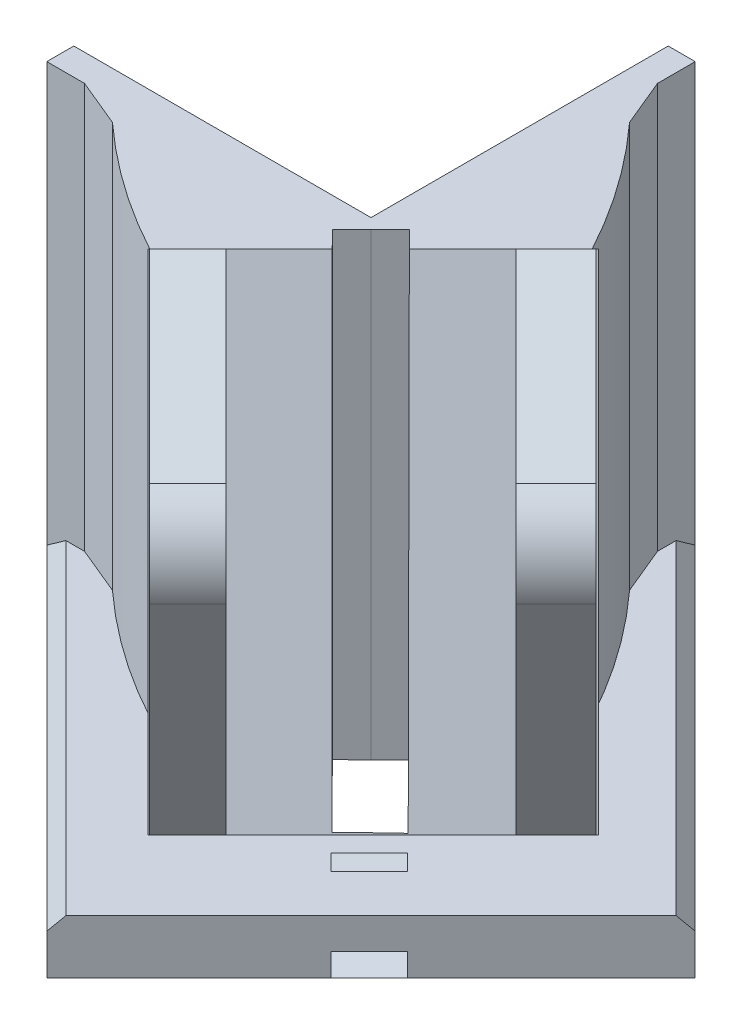
from build123d import *

# Parameters (mm, degrees)
EXTRUDE_1_DEPTH          = 150
EXTRUDE_2_DEPTH          = 150
CUT_EXTRUDE_3_DEPTH      = 161
CHAMFER_4_SIZE           = 10
CHAMFER_5_SIZE           = 10
EXTRUDE_7_DEPTH          = 20
CHAMFER_6_SIZE           = 5
CHAMFER_7_SIZE           = 5
EXTRUDE_8_DEPTH          = 58
EXTRUDE_8_DEPTH_BACK     = 60
EXTRUDE_9_DEPTH          = 20
EXTRUDE_17_DEPTH         = 20
EXTRUDE_17_DEPTH_BACK    = 1
CUT_EXTRUDE_6_DEPTH      = 276.322275262
CUT_EXTRUDE_6_DEPTH_BACK = 276.322275262
SKETCH_13_R              = 10
CUT_EXTRUDE_8_DEPTH      = 10
CUT_EXTRUDE_8_DEPTH_BACK = 10
CUT_EXTRUDE_9_DEPTH      = 31
CUT_EXTRUDE_9_DEPTH_BACK = 182


with BuildPart() as part:
    # 草图1 → 凸台-拉伸1 (new body)
    with BuildSketch(Plane(origin=(0, 0, 0), x_dir=(1, 0, 0), z_dir=(0, 1, 0))):
        Polygon((0, 0), (0, 110), (10, 110), (10, -10), (-110, -10), (-110, 0), align=None)
    extrude(amount=EXTRUDE_1_DEPTH)

    # 草图2 → 凸台-拉伸2 (add)
    with BuildSketch(Plane(origin=(0, 150, 0), x_dir=(1, 0, 0), z_dir=(0, 1, 0))):
        Polygon((10, 86.03773993), (10, -10), (58.018869965, 38.018869965), align=None)
        Polygon((-86.03773993, -10), (10, -10), (-38.018869965, -58.018869965), align=None)
    extrude(amount=-EXTRUDE_2_DEPTH)

    # 草图5 → 切除-拉伸3 (cut)
    with BuildSketch(Plane(origin=(0, 150, 0), x_dir=(1, 0, 0), z_dir=(0, 1, 0))):
        with BuildLine():
            Line((-86.03773993, -10), (-38.018869965, -58.018869965))
            Line((-38.018869965, -58.018869965), (-30.947802153, -50.947802153))
            ThreePointArc((-30.947802153, -50.947802153), (-59.992139056, -32.491105573), (-86.03773993, -10))
        make_face()
        with BuildLine():
            Line((10, 86.03773993), (58.018869965, 38.018869965))
            Line((58.018869965, 38.018869965), (50.947802153, 30.947802153))
            ThreePointArc((50.947802153, 30.947802153), (32.491105573, 59.992139056), (10, 86.03773993))
        make_face()
    extrude(amount=-CUT_EXTRUDE_3_DEPTH, mode=Mode.SUBTRACT)

    # 倒角4
    # the kernel refuses this chamfer: 10 mm, written as the material it adds along each edge
    with BuildSketch(Plane(origin=(-86.03773993, 150, 10), x_dir=(-1, 0, 0), z_dir=(0, -1, 0))) as chamfer_4_piece_1:
        with BuildLine():
            Line((CHAMFER_4_SIZE, 0), (-7.644165176, -7.308452513))
            ThreePointArc((-7.644165176, -7.308452513), (-3.915956427, -3.825991439), (0, 0))
            Line((0, 0), (CHAMFER_4_SIZE, 0))
        make_face()
    extrude(amount=150)

    # 倒角5
    # the kernel refuses this chamfer: 10 mm, written as the material it adds along each edge
    with BuildSketch(Plane(origin=(10, 150, -86.03773993), x_dir=(0.6910568330345163, 0, 0.7228004244024105), z_dir=(0, -1, 0))) as chamfer_5_piece_1:
        with BuildLine():
            Line((10.575761882, 0), (-CHAMFER_5_SIZE * 0.722800424402, -CHAMFER_5_SIZE * 0.691056833035))
            Line((-CHAMFER_5_SIZE * 0.722800424402, -CHAMFER_5_SIZE * 0.691056833035), (0, 0))
            ThreePointArc((0, 0), (5.474432495, -0.059279789), (10.575761882, 0))
        make_face()
    extrude(amount=150)

    # 草图8 → 凸台-拉伸7 (add)
    with BuildSketch(Plane(origin=(0, 0, 0), x_dir=(-1, 0, 0), z_dir=(0, -1, 0))):
        Polygon((110, 0), (0, 0), (0, 110), (-10, 110), (-133.743686708, -13.743686708), (-73.743686708, -73.743686708), (-13.743686708, -133.743686708), (110, -10), align=None)
    extrude(amount=EXTRUDE_7_DEPTH)

    # 倒角6
    chamfer_6_edges = [part.edges().sort_by_distance(p)[0] for p in [
        (-48.128156646, 0, 71.871843354),
    ]]
    chamfer(chamfer_6_edges, length=CHAMFER_6_SIZE)

    # 倒角7
    chamfer_7_edges = [part.edges().sort_by_distance(p)[0] for p in [
        (71.871843354, 0, -48.128156646),
    ]]
    chamfer(chamfer_7_edges, length=CHAMFER_7_SIZE)

    # 草图9 → 凸台-拉伸8 (add, two sides: drawn at the far end of the back side and taken through both)
    with BuildSketch(Plane(origin=(-0.289162235, 0, 0.289162235), x_dir=(0.7071067811865451, 0, 0.70710678118655), z_dir=(-0.70710678118655, 0, 0.7071067811865451)).offset(-EXTRUDE_8_DEPTH_BACK)):
        Polygon((14.142135624, 150), (67.756418231, 0), (14.142135624, 0), align=None)
    extrude(amount=EXTRUDE_8_DEPTH + EXTRUDE_8_DEPTH_BACK)

    # 草图10 → 凸台-拉伸9 (add)
    with BuildSketch(Plane(origin=(-40.947802153, 0, 40.947802153), x_dir=(0.7071067811865452, 0, 0.7071067811865498), z_dir=(-0.7071067811865498, 0, 0.7071067811865452))):
        with BuildLine():
            Line((14.142135624, 150), (87.333768107, 126.556202944))
            ThreePointArc((87.333768107, 126.556202944), (97.811967476, 112.737019173), (98.011481853, 95.395661207))
            Line((98.011481853, 95.395661207), (67.756418231, 0))
            Line((67.756418231, 0), (14.142135624, 150))
        make_face()
    extrude(amount=-EXTRUDE_9_DEPTH)

    # 草图12 → 凸台-拉伸17 (add, two sides: drawn at the far end of the back side and taken through both)
    with BuildSketch(Plane(origin=(40.947802153, 0, -40.947802153), x_dir=(0.7071067811865452, 0, 0.7071067811865498), z_dir=(-0.7071067811865498, 0, 0.7071067811865452)).offset(-EXTRUDE_17_DEPTH_BACK)):
        with BuildLine():
            Line((14.142135624, 150), (87.333768107, 126.556202944))
            ThreePointArc((87.333768107, 126.556202944), (97.811967476, 112.737019173), (98.011481853, 95.395661207))
            Line((98.011481853, 95.395661207), (67.756418231, 0))
            Line((67.756418231, 0), (14.142135624, 150))
        make_face()
    extrude(amount=EXTRUDE_17_DEPTH + EXTRUDE_17_DEPTH_BACK)

    # 草图13 → 切除-拉伸6 (cut, two sides: drawn at the far end of the back side and taken through both)
    with BuildSketch(Plane(origin=(-40.947802153, 0, 40.947802153), x_dir=(0.7071067811865452, 0, 0.7071067811865498), z_dir=(-0.7071067811865498, 0, 0.7071067811865452)).offset(-CUT_EXTRUDE_6_DEPTH_BACK)):
        with Locations((77.042401388, 104.51514855)):
            Circle(SKETCH_13_R)
    extrude(amount=CUT_EXTRUDE_6_DEPTH + CUT_EXTRUDE_6_DEPTH_BACK, mode=Mode.SUBTRACT)

    # 草图15 → 切除-拉伸8 (cut, two sides: drawn at the far end of the back side and taken through both)
    with BuildSketch(Plane(origin=(-0.289162235, 0, 0.289162235), x_dir=(0.7071067811865451, 0, 0.70710678118655), z_dir=(-0.70710678118655, 0, 0.7071067811865451)).offset(-CUT_EXTRUDE_8_DEPTH_BACK)):
        with BuildLine():
            Line((75.824326152, 0), (84.289321881, 0))
            ThreePointArc((84.289321881, 0), (93.528695136, -7.086316984), (104.289321881, -11.535004271))
            Line((104.289321881, -11.535004271), (104.289321881, -20))
            ThreePointArc((104.289321881, -20), (89.190074528, -11.233601025), (75.824326152, 0))
        make_face()
    extrude(amount=CUT_EXTRUDE_8_DEPTH + CUT_EXTRUDE_8_DEPTH_BACK, mode=Mode.SUBTRACT)

    # 草图18 → 切除-拉伸9 (cut, two sides: drawn at the far end of the back side and taken through both)
    with BuildSketch(Plane.XZ.offset(20).offset(-CUT_EXTRUDE_9_DEPTH_BACK)):
        Polygon((40.487345, 55.004008196), (-3.380540201, 10.938796408), (3.780279879, 3.810042897), (10.964971033, -3.294651596), (54.684805363, 40.917454531), (47.574262823, 47.948826004), align=None)
    extrude(amount=CUT_EXTRUDE_9_DEPTH + CUT_EXTRUDE_9_DEPTH_BACK, mode=Mode.SUBTRACT)


solid = part.part
